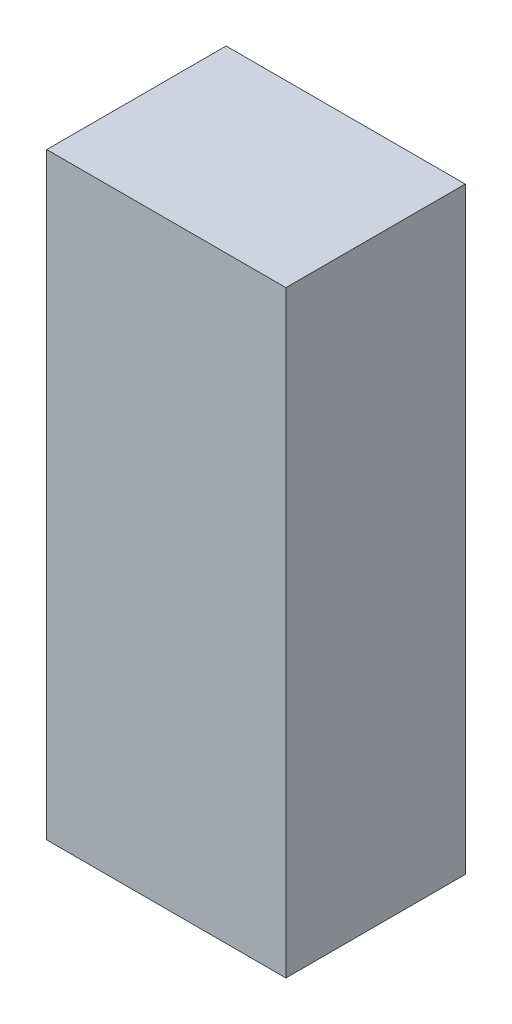
from build123d import *

# Parameters (mm, degrees)
SKETCH2_W      = 25.4
SKETCH2_H      = 63.5
EXTRUDE2_DEPTH = 19.05


with BuildPart() as part:
    # Sketch2 → Extrude2 (new body)
    with BuildSketch(Plane.XY):
        with Locations((12.7, 31.75)):
            Rectangle(SKETCH2_W, SKETCH2_H)
    extrude(amount=EXTRUDE2_DEPTH)


solid = part.part
